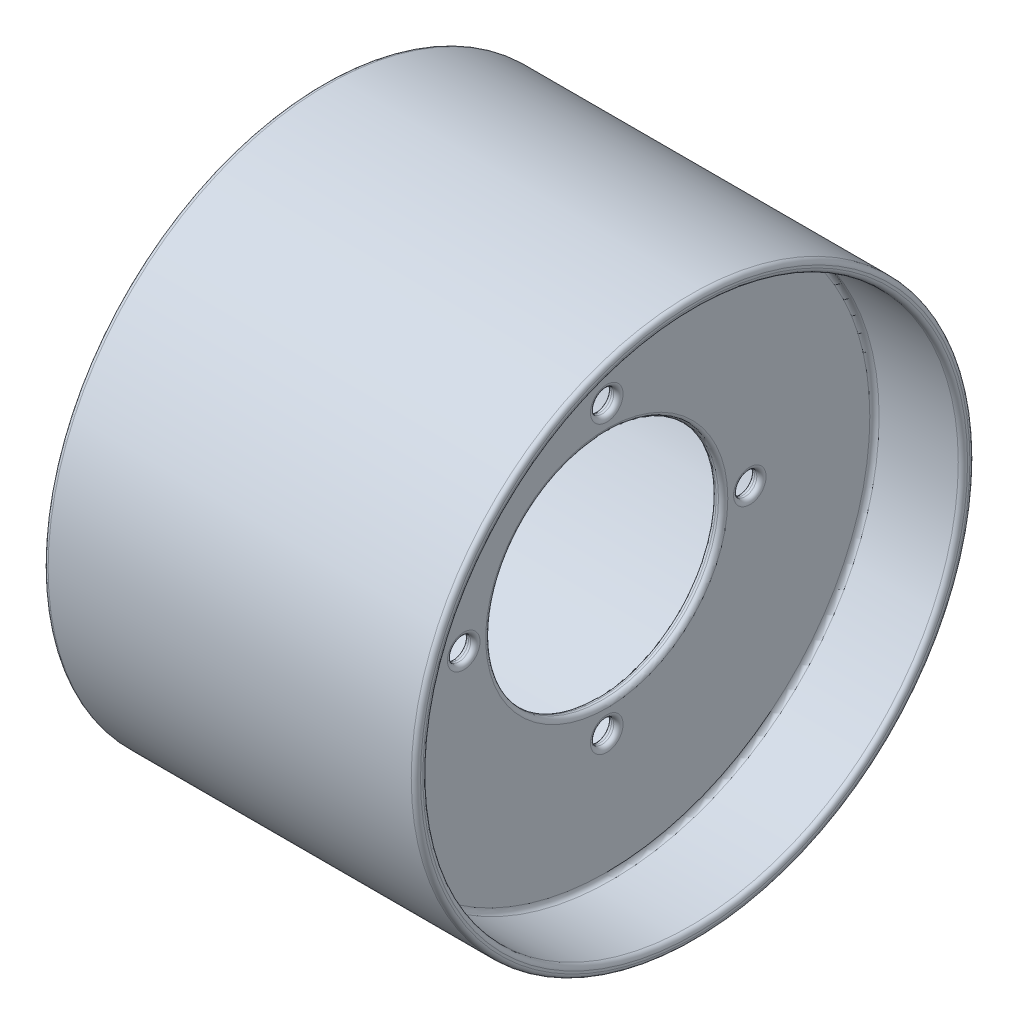
from build123d import *

# Parameters (mm, degrees)
SKETCH1_R                = 152.4
SKETCH1_R_2              = 146.05
BOSS_EXTRUDE1_DEPTH      = 203.2
FILLET3_R                = 2.54
FILLET4_R                = 2.54
BOSS_EXTRUDE2_DEPTH      = 2.54
BOSS_EXTRUDE2_DEPTH_BACK = 3.81
SKETCH2_R                = 146.05
FILLET5_R                = 2.54
FILLET6_R                = 2.54
CUT_EXTRUDE1_DEPTH       = 264.964543073
CUT_EXTRUDE1_DEPTH_BACK  = 264.964543073
SKETCH3_R                = 6.35
CUT_EXTRUDE3_DEPTH       = 264.964543073
CUT_EXTRUDE3_DEPTH_BACK  = 264.964543073
SKETCH4_R                = 63.5
FILLET7_R                = 2.54
FILLET8_R                = 2.54


with BuildPart() as part:
    # Sketch1 → Boss-Extrude1 (new body)
    with BuildSketch(Plane(origin=(0, 0, 0), x_dir=(0, 0, -1), z_dir=(1, 0, 0))):
        Circle(SKETCH1_R)
        Circle(SKETCH1_R_2, mode=Mode.SUBTRACT)
    extrude(amount=BOSS_EXTRUDE1_DEPTH)

    # Fillet3
    fillet3_edges = [part.edges().sort_by_distance(p)[0] for p in [
        (203.2, 0, 152.4),
        (203.2, 0, 146.05),
    ]]
    fillet(fillet3_edges, radius=FILLET3_R)

    # Fillet4
    fillet4_edges = [part.edges().sort_by_distance(p)[0] for p in [
        (0, 0, 152.4),
        (0, 0, 146.05),
    ]]
    fillet(fillet4_edges, radius=FILLET4_R)

    # Sketch2 → Boss-Extrude2 (add, two sides: drawn at the far end of the back side and taken through both)
    with BuildSketch(Plane(origin=(152.4, 0, 0), x_dir=(0, 0, -1), z_dir=(1, 0, 0)).offset(-BOSS_EXTRUDE2_DEPTH_BACK)):
        Circle(SKETCH2_R)
    extrude(amount=BOSS_EXTRUDE2_DEPTH + BOSS_EXTRUDE2_DEPTH_BACK)

    # Fillet5
    fillet5_edges = [part.edges().sort_by_distance(p)[0] for p in [
        (148.59, 0, 146.05),
    ]]
    fillet(fillet5_edges, radius=FILLET5_R)

    # Fillet6
    fillet6_edges = [part.edges().sort_by_distance(p)[0] for p in [
        (154.94, 0, 146.05),
    ]]
    fillet(fillet6_edges, radius=FILLET6_R)

    # Sketch3 → Cut-Extrude1 (cut, two sides: drawn at the far end of the back side and taken through both)
    with BuildSketch(Plane(origin=(152.4, 0, 0), x_dir=(0, 0, -1), z_dir=(1, 0, 0)).offset(-CUT_EXTRUDE1_DEPTH_BACK)):
        with Locations((0, 78.0415)):
            Circle(SKETCH3_R)
        with Locations((0, -78.0415)):
            Circle(SKETCH3_R)
        with Locations((78.0415, 0)):
            Circle(SKETCH3_R)
        with Locations((-78.0415, 0)):
            Circle(SKETCH3_R)
    extrude(amount=CUT_EXTRUDE1_DEPTH + CUT_EXTRUDE1_DEPTH_BACK, mode=Mode.SUBTRACT)

    # Sketch4 → Cut-Extrude3 (cut, two sides: drawn at the far end of the back side and taken through both)
    with BuildSketch(Plane(origin=(152.4, 0, 0), x_dir=(0, 0, -1), z_dir=(1, 0, 0)).offset(-CUT_EXTRUDE3_DEPTH_BACK)):
        Circle(SKETCH4_R)
    extrude(amount=CUT_EXTRUDE3_DEPTH + CUT_EXTRUDE3_DEPTH_BACK, mode=Mode.SUBTRACT)

    # Fillet7
    fillet7_edges = [part.edges().sort_by_distance(p)[0] for p in [
        (154.94, 78.0415, 6.35),
        (154.94, -78.0415, 6.35),
        (154.94, 0, -71.6915),
        (154.94, 0, 84.3915),
        (154.94, 0, 63.5),
    ]]
    fillet(fillet7_edges, radius=FILLET7_R - 0.0001)  # a hair under: the kernel refuses the full size

    # Fillet8
    fillet8_edges = [part.edges().sort_by_distance(p)[0] for p in [
        (148.59, 78.0415, 6.35),
        (148.59, -78.0415, 6.35),
        (148.59, 0, -71.6915),
        (148.59, 0, 84.3915),
        (148.59, 0, 63.5),
    ]]
    fillet(fillet8_edges, radius=FILLET8_R)


solid = part.part
